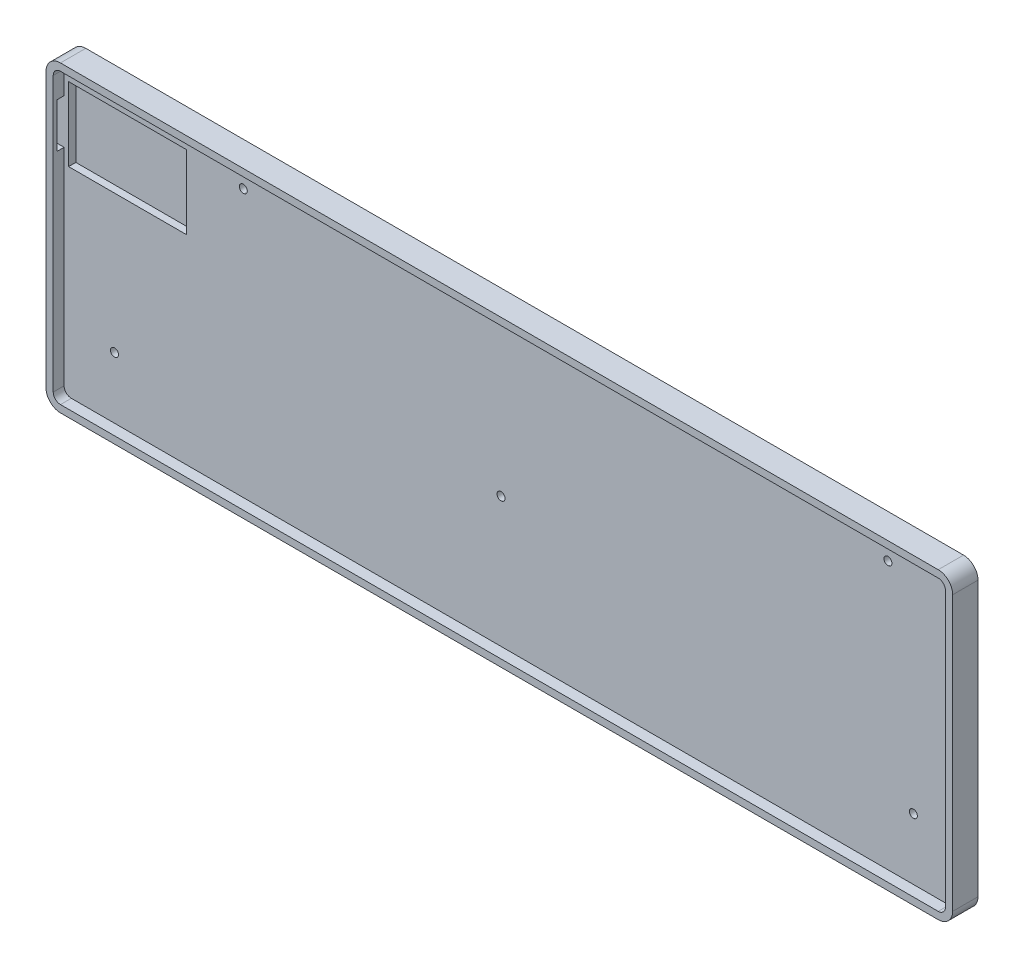
from build123d import *

# Parameters (mm, degrees)
SKETCH1_R                = 1.1
SKETCH1_R_2              = 0.95
SKETCH1_R_3              = 2.05
SKETCH1_R_4              = 1.5
SKETCH1_R_5              = 0.15
SKETCH1_R_6              = 0.5
SKETCH1_R_7              = 0.45
SKETCH1_R_8              = 1.524
SKETCH1_R_9              = 1.9939
SKETCH1_R_10             = 0.375
BOSS_EXTRUDE1_DEPTH      = 1.6
BOSS_EXTRUDE2_DEPTH      = 5
BOSS_EXTRUDE2_DEPTH_BACK = 2
BOSS_EXTRUDE5_DEPTH      = 2
BOSS_EXTRUDE5_DEPTH_BACK = 2
BOSS_EXTRUDE5_START      = 1.6
SKETCH5_R                = 1.105991344
SKETCH5_R_2              = 1.113799343
SKETCH5_R_3              = 1.1
SKETCH6_W                = 32.534762887
SKETCH6_H                = 20.354663213
CUT_EXTRUDE1_DEPTH       = 2
SKETCH7_W                = 2
SKETCH7_H                = 12.354663213
CUT_EXTRUDE2_DEPTH       = 313.177043954


with BuildPart() as part:
    # Sketch1 → Boss-Extrude1 (new body)
    with BuildSketch(Plane.XY.offset(1.6)):
        with BuildLine():
            Line((342.620001494, -108.45), (99.949998506, -108.45))
            ThreePointArc((99.949998506, -108.45), (98.535786, -109.035786), (97.95, -110.449998506))
            Line((97.95, -110.449998506), (97.95, -186.250001494))
            ThreePointArc((97.95, -186.250001494), (98.535786, -187.664214), (99.949998506, -188.25))
            Line((99.949998506, -188.25), (342.620001494, -188.25))
            ThreePointArc((342.620001494, -188.25), (344.034214, -187.664214), (344.62, -186.250001494))
            Line((344.62, -186.250001494), (344.62, -110.449998506))
            ThreePointArc((344.62, -110.449998506), (344.034214, -109.035786), (342.620001494, -108.45))
        make_face()
        with Locations((325.72, -114.3)):
            Circle(SKETCH1_R, mode=Mode.SUBTRACT)
        with Locations((330.8, -120)):
            Circle(SKETCH1_R_2, mode=Mode.SUBTRACT)
        with Locations((325.72, -120)):
            Circle(SKETCH1_R_3, mode=Mode.SUBTRACT)
        with Locations((320.64, -120)):
            Circle(SKETCH1_R_2, mode=Mode.SUBTRACT)
        with Locations((304.58, -120)):
            Circle(SKETCH1_R_2, mode=Mode.SUBTRACT)
        with Locations((299.5, -120)):
            Circle(SKETCH1_R_3, mode=Mode.SUBTRACT)
        with Locations((294.42, -120)):
            Circle(SKETCH1_R_2, mode=Mode.SUBTRACT)
        with Locations((285.58, -120)):
            Circle(SKETCH1_R_2, mode=Mode.SUBTRACT)
        with Locations((280.5, -120)):
            Circle(SKETCH1_R_3, mode=Mode.SUBTRACT)
        with Locations((329.53, -122.54)):
            Circle(SKETCH1_R_4, mode=Mode.SUBTRACT)
        with Locations((323.18, -125.08)):
            Circle(SKETCH1_R_4, mode=Mode.SUBTRACT)
        with Locations((327.37, -129)):
            Circle(SKETCH1_R_5, mode=Mode.SUBTRACT)
        with Locations((324.07, -129)):
            Circle(SKETCH1_R_5, mode=Mode.SUBTRACT)
        with Locations((303.31, -122.54)):
            Circle(SKETCH1_R_4, mode=Mode.SUBTRACT)
        with Locations((296.96, -125.08)):
            Circle(SKETCH1_R_4, mode=Mode.SUBTRACT)
        with Locations((284.31, -122.54)):
            Circle(SKETCH1_R_4, mode=Mode.SUBTRACT)
        with Locations((301.15, -129)):
            Circle(SKETCH1_R_5, mode=Mode.SUBTRACT)
        with Locations((297.85, -129)):
            Circle(SKETCH1_R_5, mode=Mode.SUBTRACT)
        with Locations((282.15, -129)):
            Circle(SKETCH1_R_5, mode=Mode.SUBTRACT)
        with Locations((275.42, -120)):
            Circle(SKETCH1_R_2, mode=Mode.SUBTRACT)
        with Locations((266.58, -120)):
            Circle(SKETCH1_R_2, mode=Mode.SUBTRACT)
        with Locations((261.5, -120)):
            Circle(SKETCH1_R_3, mode=Mode.SUBTRACT)
        with Locations((256.42, -120)):
            Circle(SKETCH1_R_2, mode=Mode.SUBTRACT)
        with Locations((247.58, -120)):
            Circle(SKETCH1_R_2, mode=Mode.SUBTRACT)
        with Locations((242.5, -120)):
            Circle(SKETCH1_R_3, mode=Mode.SUBTRACT)
        with Locations((237.42, -120)):
            Circle(SKETCH1_R_2, mode=Mode.SUBTRACT)
        with Locations((228.58, -120)):
            Circle(SKETCH1_R_2, mode=Mode.SUBTRACT)
        with Locations((223.5, -120)):
            Circle(SKETCH1_R_3, mode=Mode.SUBTRACT)
        with Locations((265.31, -122.54)):
            Circle(SKETCH1_R_4, mode=Mode.SUBTRACT)
        with Locations((277.96, -125.08)):
            Circle(SKETCH1_R_4, mode=Mode.SUBTRACT)
        with Locations((258.96, -125.08)):
            Circle(SKETCH1_R_4, mode=Mode.SUBTRACT)
        with Locations((278.85, -129)):
            Circle(SKETCH1_R_5, mode=Mode.SUBTRACT)
        with Locations((263.15, -129)):
            Circle(SKETCH1_R_5, mode=Mode.SUBTRACT)
        with Locations((259.85, -129)):
            Circle(SKETCH1_R_5, mode=Mode.SUBTRACT)
        with Locations((246.31, -122.54)):
            Circle(SKETCH1_R_4, mode=Mode.SUBTRACT)
        with Locations((239.96, -125.08)):
            Circle(SKETCH1_R_4, mode=Mode.SUBTRACT)
        with Locations((227.31, -122.54)):
            Circle(SKETCH1_R_4, mode=Mode.SUBTRACT)
        with Locations((220.96, -125.08)):
            Circle(SKETCH1_R_4, mode=Mode.SUBTRACT)
        with Locations((244.15, -129)):
            Circle(SKETCH1_R_5, mode=Mode.SUBTRACT)
        with Locations((240.85, -129)):
            Circle(SKETCH1_R_5, mode=Mode.SUBTRACT)
        with Locations((225.15, -129)):
            Circle(SKETCH1_R_5, mode=Mode.SUBTRACT)
        with Locations((221.85, -129)):
            Circle(SKETCH1_R_5, mode=Mode.SUBTRACT)
        with Locations((333.08, -139)):
            Circle(SKETCH1_R_2, mode=Mode.SUBTRACT)
        with Locations((328, -139)):
            Circle(SKETCH1_R_3, mode=Mode.SUBTRACT)
        with Locations((322.92, -139)):
            Circle(SKETCH1_R_2, mode=Mode.SUBTRACT)
        with Locations((309.33, -139)):
            Circle(SKETCH1_R_2, mode=Mode.SUBTRACT)
        with Locations((304.25, -139)):
            Circle(SKETCH1_R_3, mode=Mode.SUBTRACT)
        with Locations((299.17, -139)):
            Circle(SKETCH1_R_2, mode=Mode.SUBTRACT)
        with Locations((290.33, -139)):
            Circle(SKETCH1_R_2, mode=Mode.SUBTRACT)
        with Locations((285.25, -139)):
            Circle(SKETCH1_R_3, mode=Mode.SUBTRACT)
        with Locations((280.17, -139)):
            Circle(SKETCH1_R_2, mode=Mode.SUBTRACT)
        with Locations((331.81, -141.54)):
            Circle(SKETCH1_R_4, mode=Mode.SUBTRACT)
        with Locations((325.46, -144.08)):
            Circle(SKETCH1_R_4, mode=Mode.SUBTRACT)
        with Locations((329.65, -148)):
            Circle(SKETCH1_R_5, mode=Mode.SUBTRACT)
        with Locations((326.35, -148)):
            Circle(SKETCH1_R_5, mode=Mode.SUBTRACT)
        with Locations((308.06, -141.54)):
            Circle(SKETCH1_R_4, mode=Mode.SUBTRACT)
        with Locations((301.71, -144.08)):
            Circle(SKETCH1_R_4, mode=Mode.SUBTRACT)
        with Locations((289.06, -141.54)):
            Circle(SKETCH1_R_4, mode=Mode.SUBTRACT)
        with Locations((282.71, -144.08)):
            Circle(SKETCH1_R_4, mode=Mode.SUBTRACT)
        with Locations((305.9, -148)):
            Circle(SKETCH1_R_5, mode=Mode.SUBTRACT)
        with Locations((302.6, -148)):
            Circle(SKETCH1_R_5, mode=Mode.SUBTRACT)
        with Locations((286.9, -148)):
            Circle(SKETCH1_R_5, mode=Mode.SUBTRACT)
        with Locations((283.6, -148)):
            Circle(SKETCH1_R_5, mode=Mode.SUBTRACT)
        with Locations((271.33, -139)):
            Circle(SKETCH1_R_2, mode=Mode.SUBTRACT)
        with Locations((266.25, -139)):
            Circle(SKETCH1_R_3, mode=Mode.SUBTRACT)
        with Locations((261.17, -139)):
            Circle(SKETCH1_R_2, mode=Mode.SUBTRACT)
        with Locations((252.33, -139)):
            Circle(SKETCH1_R_2, mode=Mode.SUBTRACT)
        with Locations((247.25, -139)):
            Circle(SKETCH1_R_3, mode=Mode.SUBTRACT)
        with Locations((242.17, -139)):
            Circle(SKETCH1_R_2, mode=Mode.SUBTRACT)
        with Locations((233.33, -139)):
            Circle(SKETCH1_R_2, mode=Mode.SUBTRACT)
        with Locations((228.25, -139)):
            Circle(SKETCH1_R_3, mode=Mode.SUBTRACT)
        with Locations((223.17, -139)):
            Circle(SKETCH1_R_2, mode=Mode.SUBTRACT)
        with Locations((270.06, -141.54)):
            Circle(SKETCH1_R_4, mode=Mode.SUBTRACT)
        with Locations((251.06, -141.54)):
            Circle(SKETCH1_R_4, mode=Mode.SUBTRACT)
        with Locations((263.71, -144.08)):
            Circle(SKETCH1_R_4, mode=Mode.SUBTRACT)
        with Locations((267.9, -148)):
            Circle(SKETCH1_R_5, mode=Mode.SUBTRACT)
        with Locations((264.6, -148)):
            Circle(SKETCH1_R_5, mode=Mode.SUBTRACT)
        with Locations((244.71, -144.08)):
            Circle(SKETCH1_R_4, mode=Mode.SUBTRACT)
        with Locations((232.06, -141.54)):
            Circle(SKETCH1_R_4, mode=Mode.SUBTRACT)
        with Locations((225.71, -144.08)):
            Circle(SKETCH1_R_4, mode=Mode.SUBTRACT)
        with Locations((248.9, -148)):
            Circle(SKETCH1_R_5, mode=Mode.SUBTRACT)
        with Locations((245.6, -148)):
            Circle(SKETCH1_R_5, mode=Mode.SUBTRACT)
        with Locations((229.9, -148)):
            Circle(SKETCH1_R_5, mode=Mode.SUBTRACT)
        with Locations((226.6, -148)):
            Circle(SKETCH1_R_5, mode=Mode.SUBTRACT)
        with Locations((218.42, -120)):
            Circle(SKETCH1_R_2, mode=Mode.SUBTRACT)
        with Locations((209.58, -120)):
            Circle(SKETCH1_R_2, mode=Mode.SUBTRACT)
        with Locations((204.5, -120)):
            Circle(SKETCH1_R_3, mode=Mode.SUBTRACT)
        with Locations((199.42, -120)):
            Circle(SKETCH1_R_2, mode=Mode.SUBTRACT)
        with Locations((190.58, -120)):
            Circle(SKETCH1_R_2, mode=Mode.SUBTRACT)
        with Locations((185.5, -120)):
            Circle(SKETCH1_R_3, mode=Mode.SUBTRACT)
        with Locations((180.42, -120)):
            Circle(SKETCH1_R_2, mode=Mode.SUBTRACT)
        with Locations((171.58, -120)):
            Circle(SKETCH1_R_2, mode=Mode.SUBTRACT)
        with Locations((166.5, -120)):
            Circle(SKETCH1_R_3, mode=Mode.SUBTRACT)
        with Locations((161.42, -120)):
            Circle(SKETCH1_R_2, mode=Mode.SUBTRACT)
        with Locations((208.31, -122.54)):
            Circle(SKETCH1_R_4, mode=Mode.SUBTRACT)
        with Locations((189.31, -122.54)):
            Circle(SKETCH1_R_4, mode=Mode.SUBTRACT)
        with Locations((201.96, -125.08)):
            Circle(SKETCH1_R_4, mode=Mode.SUBTRACT)
        with Locations((206.15, -129)):
            Circle(SKETCH1_R_5, mode=Mode.SUBTRACT)
        with Locations((202.85, -129)):
            Circle(SKETCH1_R_5, mode=Mode.SUBTRACT)
        with Locations((182.96, -125.08)):
            Circle(SKETCH1_R_4, mode=Mode.SUBTRACT)
        with Locations((170.31, -122.54)):
            Circle(SKETCH1_R_4, mode=Mode.SUBTRACT)
        with Locations((163.96, -125.08)):
            Circle(SKETCH1_R_4, mode=Mode.SUBTRACT)
        with Locations((187.15, -129)):
            Circle(SKETCH1_R_5, mode=Mode.SUBTRACT)
        with Locations((183.85, -129)):
            Circle(SKETCH1_R_5, mode=Mode.SUBTRACT)
        with Locations((168.15, -129)):
            Circle(SKETCH1_R_5, mode=Mode.SUBTRACT)
        with Locations((164.85, -129)):
            Circle(SKETCH1_R_5, mode=Mode.SUBTRACT)
        with Locations((147.5, -114.3)):
            Circle(SKETCH1_R, mode=Mode.SUBTRACT)
        with Locations((129.49, -115.23)):
            Circle(SKETCH1_R_6, mode=Mode.SUBTRACT)
        with Locations((152.58, -120)):
            Circle(SKETCH1_R_2, mode=Mode.SUBTRACT)
        with Locations((147.5, -120)):
            Circle(SKETCH1_R_3, mode=Mode.SUBTRACT)
        with Locations((142.42, -120)):
            Circle(SKETCH1_R_2, mode=Mode.SUBTRACT)
        with Locations((133.58, -120)):
            Circle(SKETCH1_R_2, mode=Mode.SUBTRACT)
        with Locations((126.95, -115.23)):
            Circle(SKETCH1_R_6, mode=Mode.SUBTRACT)
        with Locations((124.41, -115.23)):
            Circle(SKETCH1_R_6, mode=Mode.SUBTRACT)
        with Locations((121.87, -115.23)):
            Circle(SKETCH1_R_6, mode=Mode.SUBTRACT)
        with Locations((119.33, -115.23)):
            Circle(SKETCH1_R_6, mode=Mode.SUBTRACT)
        with Locations((116.79, -115.23)):
            Circle(SKETCH1_R_6, mode=Mode.SUBTRACT)
        with Locations((114.25, -115.23)):
            Circle(SKETCH1_R_6, mode=Mode.SUBTRACT)
        with Locations((111.71, -115.23)):
            Circle(SKETCH1_R_6, mode=Mode.SUBTRACT)
        with Locations((109.17, -115.23)):
            Circle(SKETCH1_R_6, mode=Mode.SUBTRACT)
        with Locations((106.63, -115.23)):
            Circle(SKETCH1_R_6, mode=Mode.SUBTRACT)
        with Locations((104.09, -115.23)):
            Circle(SKETCH1_R_6, mode=Mode.SUBTRACT)
        with Locations((101.55, -115.23)):
            Circle(SKETCH1_R_6, mode=Mode.SUBTRACT)
        with Locations((128.5, -120)):
            Circle(SKETCH1_R_3, mode=Mode.SUBTRACT)
        with Locations((123.42, -120)):
            Circle(SKETCH1_R_2, mode=Mode.SUBTRACT)
        with Locations((114.58, -120)):
            Circle(SKETCH1_R_2, mode=Mode.SUBTRACT)
        with Locations((120.05, -121.150002)):
            Circle(SKETCH1_R_5, mode=Mode.SUBTRACT)
        with Locations((109.5, -120)):
            Circle(SKETCH1_R_3, mode=Mode.SUBTRACT)
        with Locations((104.42, -120)):
            Circle(SKETCH1_R_2, mode=Mode.SUBTRACT)
        with Locations((100.875, -120.825002)):
            Circle(SKETCH1_R_5, mode=Mode.SUBTRACT)
        with Locations((151.31, -122.54)):
            Circle(SKETCH1_R_4, mode=Mode.SUBTRACT)
        with Locations((144.96, -125.08)):
            Circle(SKETCH1_R_4, mode=Mode.SUBTRACT)
        with Locations((132.31, -122.54)):
            Circle(SKETCH1_R_4, mode=Mode.SUBTRACT)
        with Locations((149.15, -129)):
            Circle(SKETCH1_R_5, mode=Mode.SUBTRACT)
        with Locations((145.85, -129)):
            Circle(SKETCH1_R_5, mode=Mode.SUBTRACT)
        with Locations((129.49, -130.47)):
            Circle(SKETCH1_R_6, mode=Mode.SUBTRACT)
        with Locations((120.05, -124.449998)):
            Circle(SKETCH1_R_5, mode=Mode.SUBTRACT)
        with Locations((125.96, -125.08)):
            Circle(SKETCH1_R_4, mode=Mode.SUBTRACT)
        with Locations((113.31, -122.54)):
            Circle(SKETCH1_R_4, mode=Mode.SUBTRACT)
        with Locations((100.875, -124.124998)):
            Circle(SKETCH1_R_5, mode=Mode.SUBTRACT)
        with Locations((106.96, -125.08)):
            Circle(SKETCH1_R_4, mode=Mode.SUBTRACT)
        with Locations((126.95, -130.47)):
            Circle(SKETCH1_R_6, mode=Mode.SUBTRACT)
        with Locations((124.41, -130.47)):
            Circle(SKETCH1_R_6, mode=Mode.SUBTRACT)
        with Locations((121.87, -130.47)):
            Circle(SKETCH1_R_6, mode=Mode.SUBTRACT)
        with Locations((119.33, -130.47)):
            Circle(SKETCH1_R_6, mode=Mode.SUBTRACT)
        with Locations((116.79, -130.47)):
            Circle(SKETCH1_R_6, mode=Mode.SUBTRACT)
        with Locations((114.25, -130.47)):
            Circle(SKETCH1_R_6, mode=Mode.SUBTRACT)
        with Locations((111.71, -130.47)):
            Circle(SKETCH1_R_6, mode=Mode.SUBTRACT)
        with Locations((109.17, -130.47)):
            Circle(SKETCH1_R_6, mode=Mode.SUBTRACT)
        with Locations((106.63, -130.47)):
            Circle(SKETCH1_R_6, mode=Mode.SUBTRACT)
        with Locations((104.09, -130.47)):
            Circle(SKETCH1_R_6, mode=Mode.SUBTRACT)
        with Locations((101.55, -130.47)):
            Circle(SKETCH1_R_6, mode=Mode.SUBTRACT)
        with Locations((214.33, -139)):
            Circle(SKETCH1_R_2, mode=Mode.SUBTRACT)
        with Locations((209.25, -139)):
            Circle(SKETCH1_R_3, mode=Mode.SUBTRACT)
        with Locations((204.17, -139)):
            Circle(SKETCH1_R_2, mode=Mode.SUBTRACT)
        with Locations((195.33, -139)):
            Circle(SKETCH1_R_2, mode=Mode.SUBTRACT)
        with Locations((190.25, -139)):
            Circle(SKETCH1_R_3, mode=Mode.SUBTRACT)
        with Locations((185.17, -139)):
            Circle(SKETCH1_R_2, mode=Mode.SUBTRACT)
        with Locations((176.33, -139)):
            Circle(SKETCH1_R_2, mode=Mode.SUBTRACT)
        with Locations((171.25, -139)):
            Circle(SKETCH1_R_3, mode=Mode.SUBTRACT)
        with Locations((166.17, -139)):
            Circle(SKETCH1_R_2, mode=Mode.SUBTRACT)
        with Locations((213.06, -141.54)):
            Circle(SKETCH1_R_4, mode=Mode.SUBTRACT)
        with Locations((206.71, -144.08)):
            Circle(SKETCH1_R_4, mode=Mode.SUBTRACT)
        with Locations((194.06, -141.54)):
            Circle(SKETCH1_R_4, mode=Mode.SUBTRACT)
        with Locations((210.9, -148)):
            Circle(SKETCH1_R_5, mode=Mode.SUBTRACT)
        with Locations((207.6, -148)):
            Circle(SKETCH1_R_5, mode=Mode.SUBTRACT)
        with Locations((191.9, -148)):
            Circle(SKETCH1_R_5, mode=Mode.SUBTRACT)
        with Locations((175.06, -141.54)):
            Circle(SKETCH1_R_4, mode=Mode.SUBTRACT)
        with Locations((187.71, -144.08)):
            Circle(SKETCH1_R_4, mode=Mode.SUBTRACT)
        with Locations((168.71, -144.08)):
            Circle(SKETCH1_R_4, mode=Mode.SUBTRACT)
        with Locations((188.6, -148)):
            Circle(SKETCH1_R_5, mode=Mode.SUBTRACT)
        with Locations((172.9, -148)):
            Circle(SKETCH1_R_5, mode=Mode.SUBTRACT)
        with Locations((169.6, -148)):
            Circle(SKETCH1_R_5, mode=Mode.SUBTRACT)
        with Locations((157.33, -139)):
            Circle(SKETCH1_R_2, mode=Mode.SUBTRACT)
        with Locations((152.25, -139)):
            Circle(SKETCH1_R_3, mode=Mode.SUBTRACT)
        with Locations((147.17, -139)):
            Circle(SKETCH1_R_2, mode=Mode.SUBTRACT)
        with Locations((138.33, -139)):
            Circle(SKETCH1_R_2, mode=Mode.SUBTRACT)
        with Locations((133.25, -139)):
            Circle(SKETCH1_R_3, mode=Mode.SUBTRACT)
        with Locations((128.17, -139)):
            Circle(SKETCH1_R_2, mode=Mode.SUBTRACT)
        with Locations((116.955, -139)):
            Circle(SKETCH1_R_2, mode=Mode.SUBTRACT)
        with Locations((99.78, -137.775)):
            Circle(SKETCH1_R_7, mode=Mode.SUBTRACT)
        with Locations((111.875, -139)):
            Circle(SKETCH1_R_3, mode=Mode.SUBTRACT)
        with Locations((106.795, -139)):
            Circle(SKETCH1_R_2, mode=Mode.SUBTRACT)
        with Locations((99.78, -140.775)):
            Circle(SKETCH1_R_7, mode=Mode.SUBTRACT)
        with Locations((156.06, -141.54)):
            Circle(SKETCH1_R_4, mode=Mode.SUBTRACT)
        with Locations((149.71, -144.08)):
            Circle(SKETCH1_R_4, mode=Mode.SUBTRACT)
        with Locations((137.06, -141.54)):
            Circle(SKETCH1_R_4, mode=Mode.SUBTRACT)
        with Locations((130.71, -144.08)):
            Circle(SKETCH1_R_4, mode=Mode.SUBTRACT)
        with Locations((153.9, -148)):
            Circle(SKETCH1_R_5, mode=Mode.SUBTRACT)
        with Locations((150.6, -148)):
            Circle(SKETCH1_R_5, mode=Mode.SUBTRACT)
        with Locations((134.9, -148)):
            Circle(SKETCH1_R_5, mode=Mode.SUBTRACT)
        with Locations((131.6, -148)):
            Circle(SKETCH1_R_5, mode=Mode.SUBTRACT)
        with Locations((115.685, -141.54)):
            Circle(SKETCH1_R_4, mode=Mode.SUBTRACT)
        with Locations((109.335, -144.08)):
            Circle(SKETCH1_R_4, mode=Mode.SUBTRACT)
        with Locations((113.525, -148)):
            Circle(SKETCH1_R_5, mode=Mode.SUBTRACT)
        with Locations((110.225, -148)):
            Circle(SKETCH1_R_5, mode=Mode.SUBTRACT)
        with Locations((337.83, -158)):
            Circle(SKETCH1_R_2, mode=Mode.SUBTRACT)
        with Locations((332.75, -158)):
            Circle(SKETCH1_R_3, mode=Mode.SUBTRACT)
        with Locations((327.67, -158)):
            Circle(SKETCH1_R_2, mode=Mode.SUBTRACT)
        with Locations((318.83, -158)):
            Circle(SKETCH1_R_2, mode=Mode.SUBTRACT)
        with Locations((313.75, -158)):
            Circle(SKETCH1_R_3, mode=Mode.SUBTRACT)
        with Locations((308.67, -158)):
            Circle(SKETCH1_R_2, mode=Mode.SUBTRACT)
        with Locations((299.83, -158)):
            Circle(SKETCH1_R_2, mode=Mode.SUBTRACT)
        with Locations((294.75, -158)):
            Circle(SKETCH1_R_3, mode=Mode.SUBTRACT)
        with Locations((289.67, -158)):
            Circle(SKETCH1_R_2, mode=Mode.SUBTRACT)
        with Locations((280.83, -158)):
            Circle(SKETCH1_R_2, mode=Mode.SUBTRACT)
        with Locations((336.56, -160.54)):
            Circle(SKETCH1_R_4, mode=Mode.SUBTRACT)
        with Locations((330.21, -163.08)):
            Circle(SKETCH1_R_4, mode=Mode.SUBTRACT)
        with Locations((317.56, -160.54)):
            Circle(SKETCH1_R_4, mode=Mode.SUBTRACT)
        with Locations((311.21, -163.08)):
            Circle(SKETCH1_R_4, mode=Mode.SUBTRACT)
        with Locations((334.4, -167)):
            Circle(SKETCH1_R_5, mode=Mode.SUBTRACT)
        with Locations((331.1, -167)):
            Circle(SKETCH1_R_5, mode=Mode.SUBTRACT)
        with Locations((315.4, -167)):
            Circle(SKETCH1_R_5, mode=Mode.SUBTRACT)
        with Locations((312.1, -167)):
            Circle(SKETCH1_R_5, mode=Mode.SUBTRACT)
        with Locations((298.56, -160.54)):
            Circle(SKETCH1_R_4, mode=Mode.SUBTRACT)
        with Locations((279.56, -160.54)):
            Circle(SKETCH1_R_4, mode=Mode.SUBTRACT)
        with Locations((292.21, -163.08)):
            Circle(SKETCH1_R_4, mode=Mode.SUBTRACT)
        with Locations((296.4, -167)):
            Circle(SKETCH1_R_5, mode=Mode.SUBTRACT)
        with Locations((293.1, -167)):
            Circle(SKETCH1_R_5, mode=Mode.SUBTRACT)
        with Locations((275.75, -158)):
            Circle(SKETCH1_R_3, mode=Mode.SUBTRACT)
        with Locations((270.67, -158)):
            Circle(SKETCH1_R_2, mode=Mode.SUBTRACT)
        with Locations((261.83, -158)):
            Circle(SKETCH1_R_2, mode=Mode.SUBTRACT)
        with Locations((256.75, -158)):
            Circle(SKETCH1_R_3, mode=Mode.SUBTRACT)
        with Locations((251.67, -158)):
            Circle(SKETCH1_R_2, mode=Mode.SUBTRACT)
        with Locations((242.83, -158)):
            Circle(SKETCH1_R_2, mode=Mode.SUBTRACT)
        with Locations((237.75, -158)):
            Circle(SKETCH1_R_3, mode=Mode.SUBTRACT)
        with Locations((232.67, -158)):
            Circle(SKETCH1_R_2, mode=Mode.SUBTRACT)
        with Locations((223.83, -158)):
            Circle(SKETCH1_R_2, mode=Mode.SUBTRACT)
        with Locations((273.21, -163.08)):
            Circle(SKETCH1_R_4, mode=Mode.SUBTRACT)
        with Locations((260.56, -160.54)):
            Circle(SKETCH1_R_4, mode=Mode.SUBTRACT)
        with Locations((254.21, -163.08)):
            Circle(SKETCH1_R_4, mode=Mode.SUBTRACT)
        with Locations((277.4, -167)):
            Circle(SKETCH1_R_5, mode=Mode.SUBTRACT)
        with Locations((274.1, -167)):
            Circle(SKETCH1_R_5, mode=Mode.SUBTRACT)
        with Locations((258.4, -167)):
            Circle(SKETCH1_R_5, mode=Mode.SUBTRACT)
        with Locations((255.1, -167)):
            Circle(SKETCH1_R_5, mode=Mode.SUBTRACT)
        with Locations((241.56, -160.54)):
            Circle(SKETCH1_R_4, mode=Mode.SUBTRACT)
        with Locations((235.21, -163.08)):
            Circle(SKETCH1_R_4, mode=Mode.SUBTRACT)
        with Locations((222.56, -160.54)):
            Circle(SKETCH1_R_4, mode=Mode.SUBTRACT)
        with Locations((239.4, -167)):
            Circle(SKETCH1_R_5, mode=Mode.SUBTRACT)
        with Locations((236.1, -167)):
            Circle(SKETCH1_R_5, mode=Mode.SUBTRACT)
        with Locations((220.4, -167)):
            Circle(SKETCH1_R_5, mode=Mode.SUBTRACT)
        with Locations((332.75, -171.3)):
            Circle(SKETCH1_R, mode=Mode.SUBTRACT)
        with Locations((337.83, -177)):
            Circle(SKETCH1_R_2, mode=Mode.SUBTRACT)
        with Locations((332.75, -177)):
            Circle(SKETCH1_R_3, mode=Mode.SUBTRACT)
        with Locations((327.67, -177)):
            Circle(SKETCH1_R_2, mode=Mode.SUBTRACT)
        with Locations((318.83, -177)):
            Circle(SKETCH1_R_2, mode=Mode.SUBTRACT)
        with Locations((313.75, -177)):
            Circle(SKETCH1_R_3, mode=Mode.SUBTRACT)
        with Locations((308.67, -177)):
            Circle(SKETCH1_R_2, mode=Mode.SUBTRACT)
        with Locations((299.83, -177)):
            Circle(SKETCH1_R_2, mode=Mode.SUBTRACT)
        with Locations((294.75, -177)):
            Circle(SKETCH1_R_3, mode=Mode.SUBTRACT)
        with Locations((289.67, -177)):
            Circle(SKETCH1_R_2, mode=Mode.SUBTRACT)
        with Locations((280.83, -177)):
            Circle(SKETCH1_R_2, mode=Mode.SUBTRACT)
        with Locations((336.56, -179.54)):
            Circle(SKETCH1_R_4, mode=Mode.SUBTRACT)
        with Locations((330.21, -182.08)):
            Circle(SKETCH1_R_4, mode=Mode.SUBTRACT)
        with Locations((317.56, -179.54)):
            Circle(SKETCH1_R_4, mode=Mode.SUBTRACT)
        with Locations((311.21, -182.08)):
            Circle(SKETCH1_R_4, mode=Mode.SUBTRACT)
        with Locations((334.4, -186)):
            Circle(SKETCH1_R_5, mode=Mode.SUBTRACT)
        with Locations((331.1, -186)):
            Circle(SKETCH1_R_5, mode=Mode.SUBTRACT)
        with Locations((315.4, -186)):
            Circle(SKETCH1_R_5, mode=Mode.SUBTRACT)
        with Locations((312.1, -186)):
            Circle(SKETCH1_R_5, mode=Mode.SUBTRACT)
        with Locations((298.56, -179.54)):
            Circle(SKETCH1_R_4, mode=Mode.SUBTRACT)
        with Locations((279.56, -179.54)):
            Circle(SKETCH1_R_4, mode=Mode.SUBTRACT)
        with Locations((292.21, -182.08)):
            Circle(SKETCH1_R_4, mode=Mode.SUBTRACT)
        with Locations((296.4, -186)):
            Circle(SKETCH1_R_5, mode=Mode.SUBTRACT)
        with Locations((293.1, -186)):
            Circle(SKETCH1_R_5, mode=Mode.SUBTRACT)
        with Locations((256.813, -170.015)):
            Circle(SKETCH1_R_8, mode=Mode.SUBTRACT)
        with Locations((275.75, -177)):
            Circle(SKETCH1_R_3, mode=Mode.SUBTRACT)
        with Locations((270.67, -177)):
            Circle(SKETCH1_R_2, mode=Mode.SUBTRACT)
        with Locations((249.955, -177)):
            Circle(SKETCH1_R_2, mode=Mode.SUBTRACT)
        with Locations((232.937, -170.015)):
            Circle(SKETCH1_R_8, mode=Mode.SUBTRACT)
        with Locations((244.875, -177)):
            Circle(SKETCH1_R_3, mode=Mode.SUBTRACT)
        with Locations((239.795, -177)):
            Circle(SKETCH1_R_2, mode=Mode.SUBTRACT)
        with Locations((273.21, -182.08)):
            Circle(SKETCH1_R_4, mode=Mode.SUBTRACT)
        with Locations((277.4, -186)):
            Circle(SKETCH1_R_5, mode=Mode.SUBTRACT)
        with Locations((274.1, -186)):
            Circle(SKETCH1_R_5, mode=Mode.SUBTRACT)
        with Locations((256.813, -185.225)):
            Circle(SKETCH1_R_9, mode=Mode.SUBTRACT)
        with Locations((248.685, -179.54)):
            Circle(SKETCH1_R_4, mode=Mode.SUBTRACT)
        with Locations((242.335, -182.08)):
            Circle(SKETCH1_R_4, mode=Mode.SUBTRACT)
        with Locations((246.525, -186)):
            Circle(SKETCH1_R_5, mode=Mode.SUBTRACT)
        with Locations((243.225, -186)):
            Circle(SKETCH1_R_5, mode=Mode.SUBTRACT)
        with Locations((232.937, -185.225)):
            Circle(SKETCH1_R_9, mode=Mode.SUBTRACT)
        with Locations((218.75, -152.3)):
            Circle(SKETCH1_R, mode=Mode.SUBTRACT)
        with Locations((218.75, -158)):
            Circle(SKETCH1_R_3, mode=Mode.SUBTRACT)
        with Locations((213.67, -158)):
            Circle(SKETCH1_R_2, mode=Mode.SUBTRACT)
        with Locations((204.83, -158)):
            Circle(SKETCH1_R_2, mode=Mode.SUBTRACT)
        with Locations((199.75, -158)):
            Circle(SKETCH1_R_3, mode=Mode.SUBTRACT)
        with Locations((194.67, -158)):
            Circle(SKETCH1_R_2, mode=Mode.SUBTRACT)
        with Locations((185.83, -158)):
            Circle(SKETCH1_R_2, mode=Mode.SUBTRACT)
        with Locations((180.75, -158)):
            Circle(SKETCH1_R_3, mode=Mode.SUBTRACT)
        with Locations((175.67, -158)):
            Circle(SKETCH1_R_2, mode=Mode.SUBTRACT)
        with Locations((166.83, -158)):
            Circle(SKETCH1_R_2, mode=Mode.SUBTRACT)
        with Locations((161.75, -158)):
            Circle(SKETCH1_R_3, mode=Mode.SUBTRACT)
        with Locations((216.21, -163.08)):
            Circle(SKETCH1_R_4, mode=Mode.SUBTRACT)
        with Locations((203.56, -160.54)):
            Circle(SKETCH1_R_4, mode=Mode.SUBTRACT)
        with Locations((197.21, -163.08)):
            Circle(SKETCH1_R_4, mode=Mode.SUBTRACT)
        with Locations((217.1, -167)):
            Circle(SKETCH1_R_5, mode=Mode.SUBTRACT)
        with Locations((201.4, -167)):
            Circle(SKETCH1_R_5, mode=Mode.SUBTRACT)
        with Locations((198.1, -167)):
            Circle(SKETCH1_R_5, mode=Mode.SUBTRACT)
        with Locations((184.56, -160.54)):
            Circle(SKETCH1_R_4, mode=Mode.SUBTRACT)
        with Locations((178.21, -163.08)):
            Circle(SKETCH1_R_4, mode=Mode.SUBTRACT)
        with Locations((165.56, -160.54)):
            Circle(SKETCH1_R_4, mode=Mode.SUBTRACT)
        with Locations((159.21, -163.08)):
            Circle(SKETCH1_R_4, mode=Mode.SUBTRACT)
        with Locations((182.4, -167)):
            Circle(SKETCH1_R_5, mode=Mode.SUBTRACT)
        with Locations((179.1, -167)):
            Circle(SKETCH1_R_5, mode=Mode.SUBTRACT)
        with Locations((163.4, -167)):
            Circle(SKETCH1_R_5, mode=Mode.SUBTRACT)
        with Locations((160.1, -167)):
            Circle(SKETCH1_R_5, mode=Mode.SUBTRACT)
        with Locations((130.6, -154.325)):
            Circle(SKETCH1_R_10, mode=Mode.SUBTRACT)
        with Locations((156.67, -158)):
            Circle(SKETCH1_R_2, mode=Mode.SUBTRACT)
        with Locations((147.83, -158)):
            Circle(SKETCH1_R_2, mode=Mode.SUBTRACT)
        with Locations((142.75, -158)):
            Circle(SKETCH1_R_3, mode=Mode.SUBTRACT)
        with Locations((137.67, -158)):
            Circle(SKETCH1_R_2, mode=Mode.SUBTRACT)
        with Locations((128.6, -154.325)):
            Circle(SKETCH1_R_10, mode=Mode.SUBTRACT)
        with Locations((121.705, -158)):
            Circle(SKETCH1_R_2, mode=Mode.SUBTRACT)
        with Locations((116.625, -158)):
            Circle(SKETCH1_R_3, mode=Mode.SUBTRACT)
        with Locations((111.545, -158)):
            Circle(SKETCH1_R_2, mode=Mode.SUBTRACT)
        with Locations((146.56, -160.54)):
            Circle(SKETCH1_R_4, mode=Mode.SUBTRACT)
        with Locations((140.21, -163.08)):
            Circle(SKETCH1_R_4, mode=Mode.SUBTRACT)
        with Locations((144.4, -167)):
            Circle(SKETCH1_R_5, mode=Mode.SUBTRACT)
        with Locations((141.1, -167)):
            Circle(SKETCH1_R_5, mode=Mode.SUBTRACT)
        with Locations((120.435, -160.54)):
            Circle(SKETCH1_R_4, mode=Mode.SUBTRACT)
        with Locations((114.085, -163.08)):
            Circle(SKETCH1_R_4, mode=Mode.SUBTRACT)
        with Locations((118.275, -167)):
            Circle(SKETCH1_R_5, mode=Mode.SUBTRACT)
        with Locations((114.975, -167)):
            Circle(SKETCH1_R_5, mode=Mode.SUBTRACT)
        with Locations((209.313, -170.04)):
            Circle(SKETCH1_R_8, mode=Mode.SUBTRACT)
        with Locations((202.455, -177)):
            Circle(SKETCH1_R_2, mode=Mode.SUBTRACT)
        with Locations((197.375, -177)):
            Circle(SKETCH1_R_3, mode=Mode.SUBTRACT)
        with Locations((192.295, -177)):
            Circle(SKETCH1_R_2, mode=Mode.SUBTRACT)
        with Locations((185.437, -170.04)):
            Circle(SKETCH1_R_8, mode=Mode.SUBTRACT)
        with Locations((164.455, -177)):
            Circle(SKETCH1_R_2, mode=Mode.SUBTRACT)
        with Locations((159.375, -177)):
            Circle(SKETCH1_R_3, mode=Mode.SUBTRACT)
        with Locations((201.185, -179.54)):
            Circle(SKETCH1_R_4, mode=Mode.SUBTRACT)
        with Locations((194.835, -182.08)):
            Circle(SKETCH1_R_4, mode=Mode.SUBTRACT)
        with Locations((209.313, -185.25)):
            Circle(SKETCH1_R_9, mode=Mode.SUBTRACT)
        with Locations((199.025, -186)):
            Circle(SKETCH1_R_5, mode=Mode.SUBTRACT)
        with Locations((195.725, -186)):
            Circle(SKETCH1_R_5, mode=Mode.SUBTRACT)
        with Locations((163.185, -179.54)):
            Circle(SKETCH1_R_4, mode=Mode.SUBTRACT)
        with Locations((185.437, -185.25)):
            Circle(SKETCH1_R_9, mode=Mode.SUBTRACT)
        with Locations((161.025, -186)):
            Circle(SKETCH1_R_5, mode=Mode.SUBTRACT)
        with Locations((154.295, -177)):
            Circle(SKETCH1_R_2, mode=Mode.SUBTRACT)
        with Locations((140.705, -177)):
            Circle(SKETCH1_R_2, mode=Mode.SUBTRACT)
        with Locations((135.625, -177)):
            Circle(SKETCH1_R_3, mode=Mode.SUBTRACT)
        with Locations((130.545, -177)):
            Circle(SKETCH1_R_2, mode=Mode.SUBTRACT)
        with Locations((111.875, -171.3)):
            Circle(SKETCH1_R, mode=Mode.SUBTRACT)
        with Locations((116.955, -177)):
            Circle(SKETCH1_R_2, mode=Mode.SUBTRACT)
        with Locations((111.875, -177)):
            Circle(SKETCH1_R_3, mode=Mode.SUBTRACT)
        with Locations((106.795, -177)):
            Circle(SKETCH1_R_2, mode=Mode.SUBTRACT)
        with Locations((156.835, -182.08)):
            Circle(SKETCH1_R_4, mode=Mode.SUBTRACT)
        with Locations((139.435, -179.54)):
            Circle(SKETCH1_R_4, mode=Mode.SUBTRACT)
        with Locations((133.085, -182.08)):
            Circle(SKETCH1_R_4, mode=Mode.SUBTRACT)
        with Locations((157.725, -186)):
            Circle(SKETCH1_R_5, mode=Mode.SUBTRACT)
        with Locations((137.275, -186)):
            Circle(SKETCH1_R_5, mode=Mode.SUBTRACT)
        with Locations((133.975, -186)):
            Circle(SKETCH1_R_5, mode=Mode.SUBTRACT)
        with Locations((115.685, -179.54)):
            Circle(SKETCH1_R_4, mode=Mode.SUBTRACT)
        with Locations((109.335, -182.08)):
            Circle(SKETCH1_R_4, mode=Mode.SUBTRACT)
        with Locations((113.525, -186)):
            Circle(SKETCH1_R_5, mode=Mode.SUBTRACT)
        with Locations((110.225, -186)):
            Circle(SKETCH1_R_5, mode=Mode.SUBTRACT)
    extrude(amount=-BOSS_EXTRUDE1_DEPTH)


with BuildPart() as body_2:
    # Sketch2 → Boss-Extrude2 (new, two sides: drawn at the far end of the back side and taken through both)
    with BuildSketch(Plane.XY.offset(1.6).offset(-BOSS_EXTRUDE2_DEPTH_BACK)):
        with BuildLine():
            Line((342.620001494, -106.45), (99.949998506, -106.45))
            ThreePointArc((99.949998506, -106.45), (97.121572438, -107.621572438), (95.95, -110.449998506))
            Line((95.95, -110.449998506), (95.95, -186.250001494))
            ThreePointArc((95.95, -186.250001494), (97.121572438, -189.078427562), (99.949998506, -190.25))
            Line((99.949998506, -190.25), (342.620001494, -190.25))
            ThreePointArc((342.620001494, -190.25), (345.448427562, -189.078427562), (346.62, -186.250001494))
            Line((346.62, -186.250001494), (346.62, -110.449998506))
            ThreePointArc((346.62, -110.449998506), (345.448427562, -107.621572438), (342.620001494, -106.45))
        make_face()
        with BuildLine():
            ThreePointArc((97.95, -110.449998506), (98.535786, -109.035786), (99.949998506, -108.45))
            Line((99.949998506, -108.45), (342.620001494, -108.45))
            ThreePointArc((342.620001494, -108.45), (344.034214, -109.035786), (344.62, -110.449998506))
            Line((344.62, -110.449998506), (344.62, -186.250001494))
            ThreePointArc((344.62, -186.250001494), (344.034214, -187.664214), (342.620001494, -188.25))
            Line((342.620001494, -188.25), (99.949998506, -188.25))
            ThreePointArc((99.949998506, -188.25), (98.535786, -187.664214), (97.95, -186.250001494))
            Line((97.95, -186.250001494), (97.95, -110.449998506))
        make_face(mode=Mode.SUBTRACT)
    extrude(amount=BOSS_EXTRUDE2_DEPTH + BOSS_EXTRUDE2_DEPTH_BACK)

    # Sketch5 → Boss-Extrude5 (add, two sides: drawn at the far end of the back side and taken through both)
    with BuildSketch(Plane.XY.offset(BOSS_EXTRUDE5_START - BOSS_EXTRUDE5_DEPTH_BACK)):
        with BuildLine():
            Line((342.620001494, -108.45), (99.949998506, -108.45))
            ThreePointArc((99.949998506, -108.45), (98.535786, -109.035786), (97.95, -110.449998506))
            Line((97.95, -110.449998506), (97.95, -186.250001494))
            ThreePointArc((97.95, -186.250001494), (98.535786, -187.664214), (99.949998506, -188.25))
            Line((99.949998506, -188.25), (342.620001494, -188.25))
            ThreePointArc((342.620001494, -188.25), (344.034214, -187.664214), (344.62, -186.250001494))
            Line((344.62, -186.250001494), (344.62, -110.449998506))
            ThreePointArc((344.62, -110.449998506), (344.034214, -109.035786), (342.620001494, -108.45))
        make_face()
        with Locations((111.875, -171.3)):
            Circle(SKETCH5_R, mode=Mode.SUBTRACT)
        with Locations((218.75, -152.3)):
            Circle(SKETCH5_R_2, mode=Mode.SUBTRACT)
        with Locations((332.75, -171.3)):
            Circle(SKETCH5_R_3, mode=Mode.SUBTRACT)
        with Locations((147.5, -114.3)):
            Circle(SKETCH5_R_3, mode=Mode.SUBTRACT)
        with Locations((325.72, -114.3)):
            Circle(SKETCH5_R_3, mode=Mode.SUBTRACT)
    extrude(amount=BOSS_EXTRUDE5_DEPTH + BOSS_EXTRUDE5_DEPTH_BACK)

    # Sketch6 → Cut-Extrude1 (cut)
    with BuildSketch(Plane.XY.offset(3.6)):
        with Locations((115.468941808, -122.970077656)):
            Rectangle(SKETCH6_W, SKETCH6_H)
    extrude(amount=-CUT_EXTRUDE1_DEPTH, mode=Mode.SUBTRACT)

    # Sketch7 → Cut-Extrude2 (cut, through all)
    with BuildSketch(Plane(origin=(99.201560364, 0, 0), x_dir=(0, 0, -1), z_dir=(1, 0, 0))):
        with Locations((-4.6, -122.970077656)):
            Rectangle(SKETCH7_W, SKETCH7_H)
    extrude(amount=-CUT_EXTRUDE2_DEPTH, mode=Mode.SUBTRACT)


solid = Compound([part.part, body_2.part])
